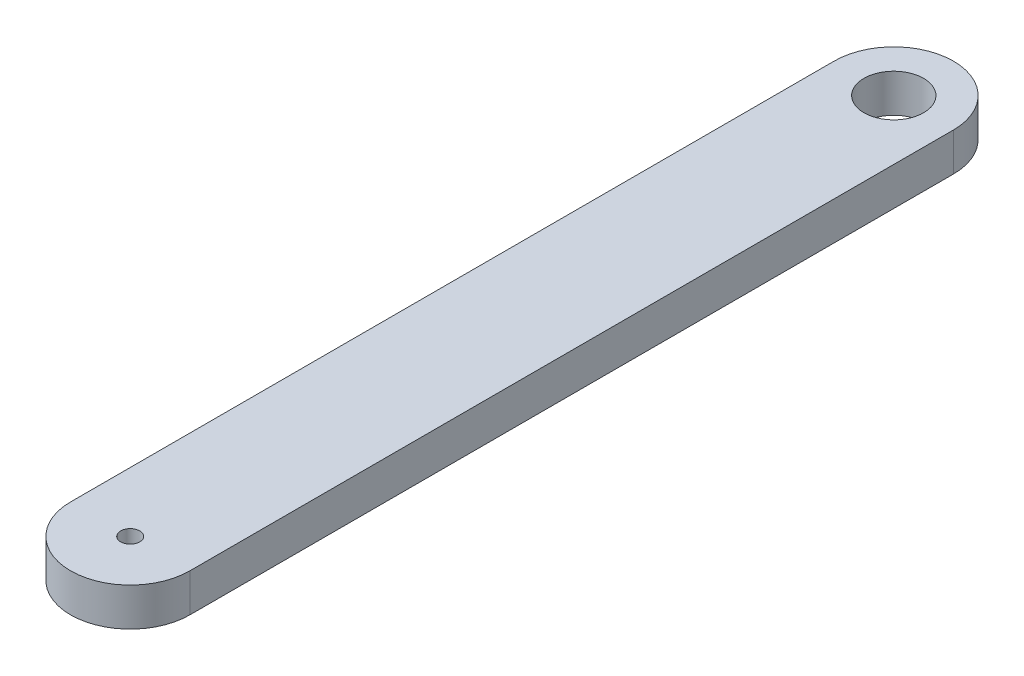
from build123d import *

# Parameters (mm, degrees)
SKETCH1_R           = 6.25
SKETCH1_R_2         = 2
BOSS_EXTRUDE1_DEPTH = 8


with BuildPart() as part:
    # Sketch1 → Boss-Extrude1 (new body)
    with BuildSketch(Plane(origin=(0, 0, 0), x_dir=(1, 0, 0), z_dir=(0, 1, 0))):
        with BuildLine():
            ThreePointArc((12.5, 160), (0, 172.5), (-12.5, 160))
            Line((-12.5, 160), (-12.5, 0))
            ThreePointArc((-12.5, 0), (0, -12.5), (12.5, 0))
            Line((12.5, 0), (12.5, 160))
        make_face()
        with Locations((0, 160)):
            Circle(SKETCH1_R, mode=Mode.SUBTRACT)
        Circle(SKETCH1_R_2, mode=Mode.SUBTRACT)
    extrude(amount=BOSS_EXTRUDE1_DEPTH)


solid = part.part
